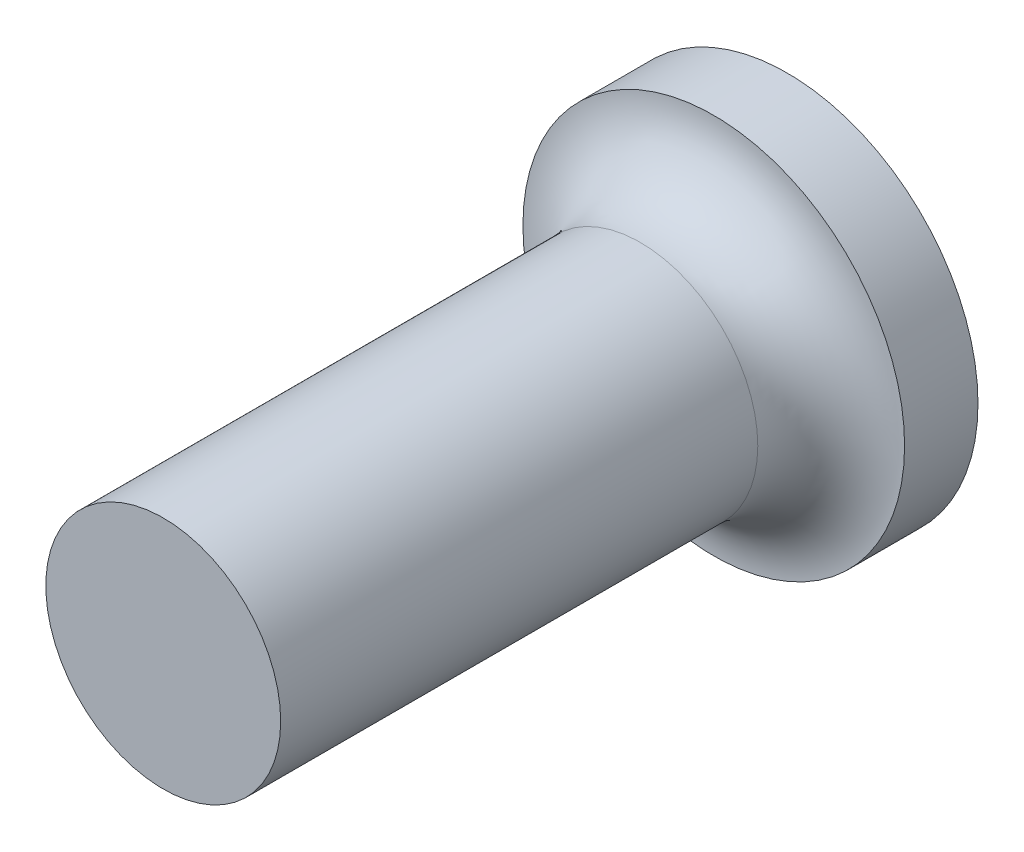
from build123d import *

# Parameters (mm, degrees)
SKETCH_1_R      = 1.6
EXTRUDE_1_DEPTH = 8.5
SKETCH_2_R      = 2.6
EXTRUDE_2_DEPTH = 1
FILLET_1_R      = 1


with BuildPart() as part:
    # Эскиз1 → Бобышка-Вытянуть1 (new body)
    with BuildSketch(Plane.XY):
        Circle(SKETCH_1_R)
    extrude(amount=EXTRUDE_1_DEPTH)

    # Эскиз2 → Бобышка-Вытянуть2 (add)
    with BuildSketch(Plane.XY):
        Circle(SKETCH_2_R)
    extrude(amount=EXTRUDE_2_DEPTH)

    # Скругление1
    fillet_1_edges = [part.edges().sort_by_distance(p)[0] for p in [
        (-1.6, 0, 1),
    ]]
    fillet(fillet_1_edges, radius=FILLET_1_R - 0.0001)  # a hair under: the kernel refuses the full size


solid = part.part
